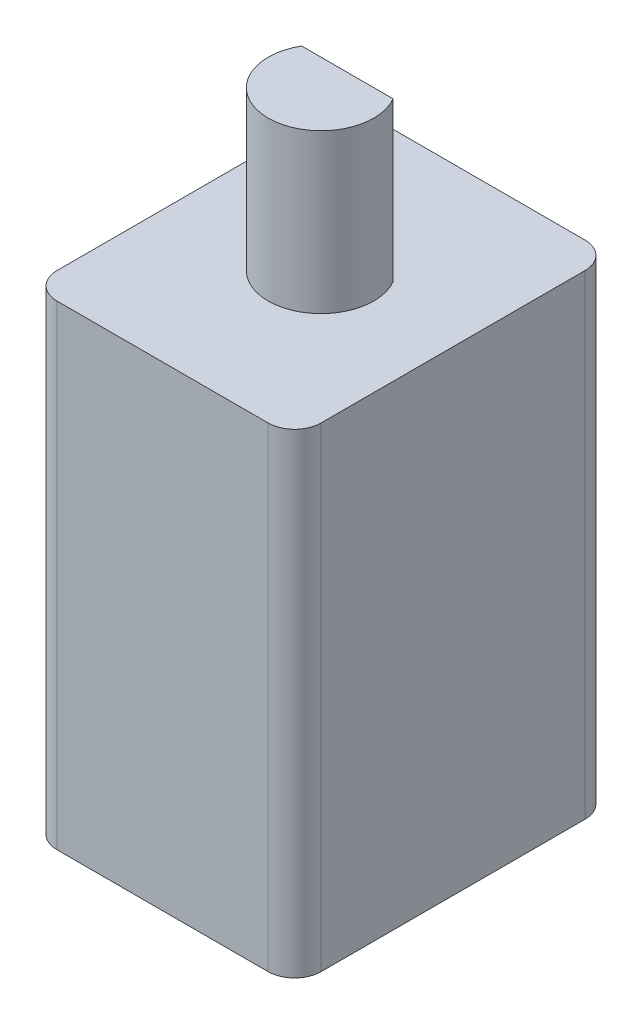
from build123d import *

# Parameters (mm, degrees)
CROQUIS1_W              = 10
CROQUIS1_H              = 12
SALIENTE_EXTRUIR1_DEPTH = 18
SALIENTE_EXTRUIR2_DEPTH = 6
REDONDEO1_R             = 1


with BuildPart() as part:
    # Croquis1 → Saliente-Extruir1 (new body)
    with BuildSketch(Plane(origin=(0, 0, 0), x_dir=(1, 0, 0), z_dir=(0, 1, 0))):
        Rectangle(CROQUIS1_W, CROQUIS1_H)
    extrude(amount=SALIENTE_EXTRUIR1_DEPTH)

    # Croquis2 → Saliente-Extruir2 (add)
    with BuildSketch(Plane(origin=(0, 18, 0), x_dir=(1, 0, 0), z_dir=(0, 1, 0))):
        with BuildLine():
            Line((-1.732050808, 1), (1.732050808, 1))
            ThreePointArc((1.732050808, 1), (0, -2), (-1.732050808, 1))
        make_face()
    extrude(amount=SALIENTE_EXTRUIR2_DEPTH)

    # Redondeo1
    redondeo1_edges = [part.edges().sort_by_distance(p)[0] for p in [
        (-5, 9, -6),
        (5, 9, -6),
        (-5, 9, 6),
        (5, 9, 6),
    ]]
    fillet(redondeo1_edges, radius=REDONDEO1_R)


solid = part.part
